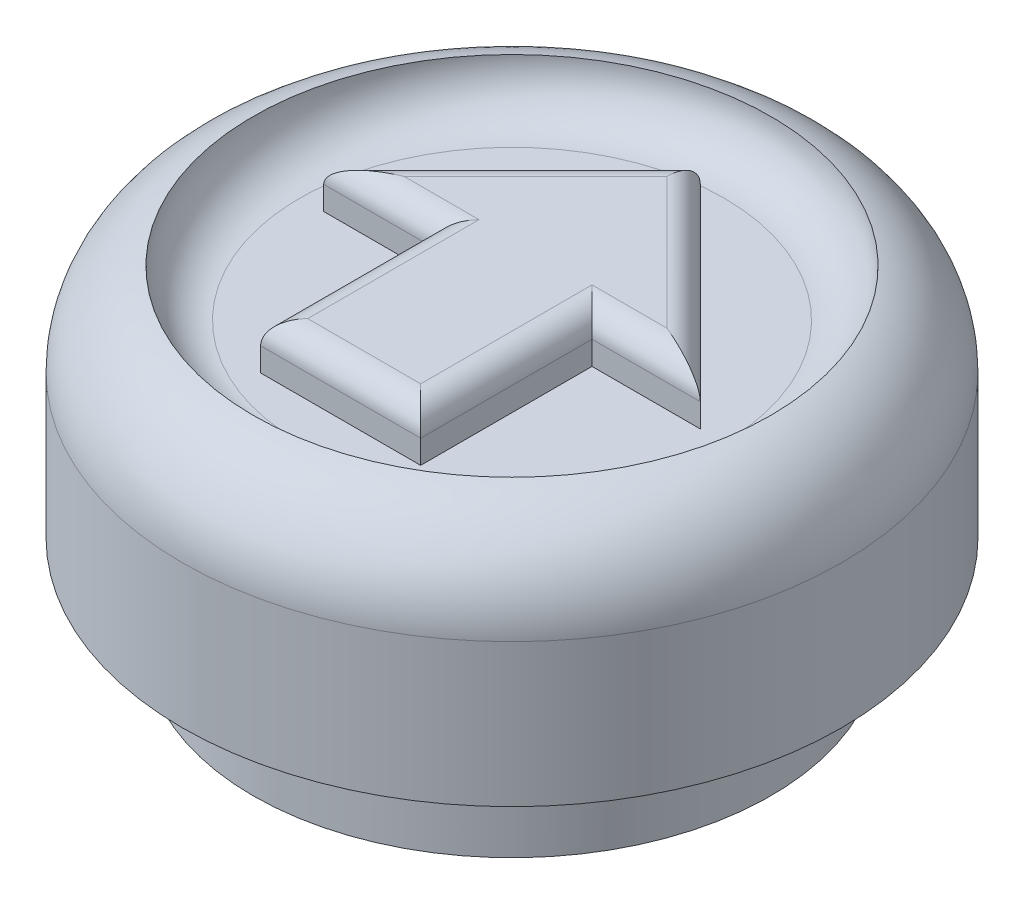
from build123d import *

# Parameters (mm, degrees)
SKETCH_1_R          = 5.5
EXTRUDE_1_DEPTH     = 7
CUT_EXTRUDE_START   = -1
SKETCH_2_R          = 5.5
CUT_EXTRUDE_1_DEPTH = 1
EXTRUDE_2_DEPTH     = 1
SKETCH_5_W          = 4
SKETCH_5_H          = 4
CUT_EXTRUDE_2_DEPTH = 3
FILLET_3_R          = 1
FILLET_4_R          = 0.5


with BuildPart() as part:
    # Эскиз1 → Бобышка-Вытянуть1 (new body)
    with BuildSketch(Plane(origin=(0, 0, 0), x_dir=(1, 0, 0), z_dir=(0, 1, 0))):
        with Locations(Location((0, 0, 0), (0, 0, 270))):
            Circle(SKETCH_1_R)
    extrude(amount=EXTRUDE_1_DEPTH)

    # Эскиз6 → Повернуть3 (revolve)
    with BuildSketch(Plane.XY, mode=Mode.PRIVATE) as revolve_3_sk:
        with BuildLine():
            Line((-4.665230635, 2), (-7, 2))
            Line((-7, 2), (-7, 3))
            Line((-7, 3), (-7, 5.035898385))
            ThreePointArc((-7, 5.035898385), (-6.582112259, 6.271585962), (-5.5, 7))
            Line((-5.5, 7), (-4.665230635, 7))
            Line((-4.665230635, 7), (-4.665230635, 3))
            Line((-4.665230635, 3), (-4.665230635, 2))
        make_face()
    revolve(revolve_3_sk.sketch.rotate(Axis((0, -1000, 0), (0, 1, 0)), 180), axis=Axis((0, -1000, 0), (0, 1, 0)))

    # Эскиз2 → Вырез-Вытянуть1 (cut)
    with BuildSketch(Plane(origin=(0, 7, 0), x_dir=(1, 0, 0), z_dir=(0, 1, 0)).offset(CUT_EXTRUDE_START)):
        with Locations(Location((0, 0, 0), (0, 0, 180))):
            Circle(SKETCH_2_R)
    extrude(amount=CUT_EXTRUDE_1_DEPTH, mode=Mode.SUBTRACT)

    # Эскиз3 → Бобышка-Вытянуть2 (add)
    with BuildSketch(Plane(origin=(0, 6, 0), x_dir=(1, 0, 0), z_dir=(0, 1, 0))):
        Polygon((0, 4), (-4, 0), (-1.7, 0), (-1.7, -3.640107036), (1.7, -3.640107036), (1.7, 0), (4, 0), align=None)
    extrude(amount=EXTRUDE_2_DEPTH)

    # Эскиз5 → Вырез-Вытянуть2 (cut)
    with BuildSketch(Plane.XZ):
        Rectangle(SKETCH_5_W, SKETCH_5_H)
    extrude(amount=-CUT_EXTRUDE_2_DEPTH, mode=Mode.SUBTRACT)

    # Скругление3
    fillet_3_edges = [part.edges().sort_by_distance(p)[0] for p in [
        (5.5, 6, 0),
    ]]
    fillet(fillet_3_edges, radius=FILLET_3_R - 0.0001)  # a hair under: the kernel refuses the full size

    # Скругление4
    fillet_4_edges = [part.edges().sort_by_distance(p)[0] for p in [
        (2, 7, -2),
        (-2, 7, -2),
        (-2.85, 7, 0),
        (-1.7, 7, 1.820053518),
        (0, 7, 3.640107036),
        (1.7, 7, 1.820053518),
        (2.85, 7, 0),
    ]]
    fillet(fillet_4_edges, radius=FILLET_4_R)


solid = part.part
